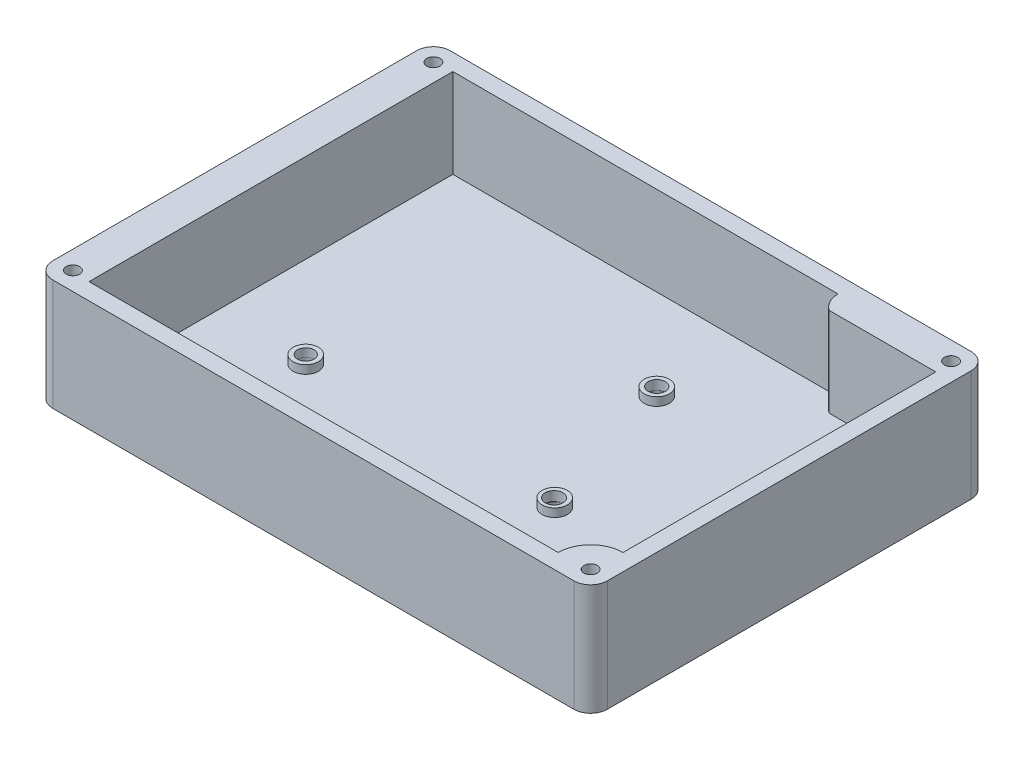
from build123d import *

# Parameters (mm, degrees)
BOSS_EXTRUDE1_DEPTH       = 20
CUT_EXTRUDE1_DEPTH        = 16
FILLET2_R                 = 3
SKETCH3_R                 = 1.2
CUT_EXTRUDE2_DEPTH        = 10
F_3_0MM_DOWEL_HOLE1_D     = 3
F_3_0MM_DOWEL_HOLE1_DEPTH = 2.298709071
F_3_0MM_DOWEL_HOLE1_TIP   = 0.901290929
SKETCH10_R                = 2.263248583
BOSS_EXTRUDE2_DEPTH       = 1.5
SKETCH15_R                = 1.475300043
SKETCH15_R_2              = 1.589470276
SKETCH15_R_3              = 1.538430873
CUT_EXTRUDE3_DEPTH        = 1.7


with BuildPart() as part:
    # Sketch1 → Boss-Extrude1 (new body)
    with BuildSketch(Plane(origin=(0, 0, 0), x_dir=(1, 0, 0), z_dir=(0, 1, 0))):
        Polygon((-48.075, 35.695), (-51.575, 35.695), (-51.575, -35.695), (-48.075, -35.695), (48.075, -35.695), (48.075, 35.695), align=None)
    extrude(amount=BOSS_EXTRUDE1_DEPTH)

    # Sketch2 → Cut-Extrude1 (cut)
    with BuildSketch(Plane(origin=(0, 20, 0), x_dir=(1, 0, 0), z_dir=(0, 1, 0))):
        with BuildLine():
            Line((-45.075, 32.695), (24.150094523, 32.695))
            ThreePointArc((24.150094523, 32.695), (24.61601976, 30.802179591), (25.907321947, 29.341907669))
            Line((25.907321947, 29.341907669), (45.075, 29.341907669))
            Line((45.075, 29.341907669), (45.075, -26.874300701))
            ThreePointArc((45.075, -26.874300701), (40.959144055, -28.579144055), (39.254300701, -32.695))
            Line((39.254300701, -32.695), (-45.075, -32.695))
            Line((-45.075, -32.695), (-45.075, 32.695))
        make_face()
    extrude(amount=-CUT_EXTRUDE1_DEPTH, mode=Mode.SUBTRACT)

    # Fillet2
    fillet2_edges = [part.edges().sort_by_distance(p)[0] for p in [
        (-51.575, 10, -35.695),
        (-51.575, 10, 35.695),
        (48.075, 10, 35.695),
        (48.075, 10, -35.695),
    ]]
    fillet(fillet2_edges, radius=FILLET2_R)

    # Sketch3 → Cut-Extrude2 (cut)
    with BuildSketch(Plane(origin=(0, 20, 0), x_dir=(1, 0, 0), z_dir=(0, 1, 0))):
        with Locations((-48.275, -32.395)):
            Circle(SKETCH3_R)
        with Locations((44.775, -32.395)):
            Circle(SKETCH3_R)
        with Locations((-48.275, 32.395)):
            Circle(SKETCH3_R)
        with Locations((44.775, 32.395)):
            Circle(SKETCH3_R)
    extrude(amount=-CUT_EXTRUDE2_DEPTH, mode=Mode.SUBTRACT)

    # Ø3.0mm Dowel Hole1
    with Locations(Plane(origin=(0, 4, 0), x_dir=(1, 0, 0), z_dir=(0, 1, 0))):
        with Locations((-28.762825269, -10.057293502), (7.749694868, 16.498857514), (15.902168376, -9.972703522)):
            Hole(F_3_0MM_DOWEL_HOLE1_D / 2, depth=F_3_0MM_DOWEL_HOLE1_DEPTH)
            with Locations((0, 0, -(F_3_0MM_DOWEL_HOLE1_DEPTH + F_3_0MM_DOWEL_HOLE1_TIP / 2))):  # 118° drill point
                Cone(0, F_3_0MM_DOWEL_HOLE1_D / 2, F_3_0MM_DOWEL_HOLE1_TIP, mode=Mode.SUBTRACT)

    # Sketch10 → Boss-Extrude2 (add)
    with BuildSketch(Plane(origin=(0, 4, 0), x_dir=(1, 0, 0), z_dir=(0, 1, 0))):
        with Locations((-28.762825269, -10.057293502)):
            Circle(SKETCH10_R)
        with Locations((15.902168376, -9.972703522)):
            Circle(SKETCH10_R)
        with Locations((7.766829255, 16.497864925)):
            Circle(SKETCH10_R)
    extrude(amount=BOSS_EXTRUDE2_DEPTH)

    # Sketch15 → Cut-Extrude3 (cut)
    with BuildSketch(Plane(origin=(0, 5.5, 0), x_dir=(1, 0, 0), z_dir=(0, 1, 0))):
        with Locations((-28.762825269, -10.057293502)):
            Circle(SKETCH15_R)
        with Locations((15.862605676, -10.057293502)):
            Circle(SKETCH15_R_2)
        with Locations((7.766829255, 16.497864925)):
            Circle(SKETCH15_R_3)
    extrude(amount=-CUT_EXTRUDE3_DEPTH, mode=Mode.SUBTRACT)


solid = part.part
